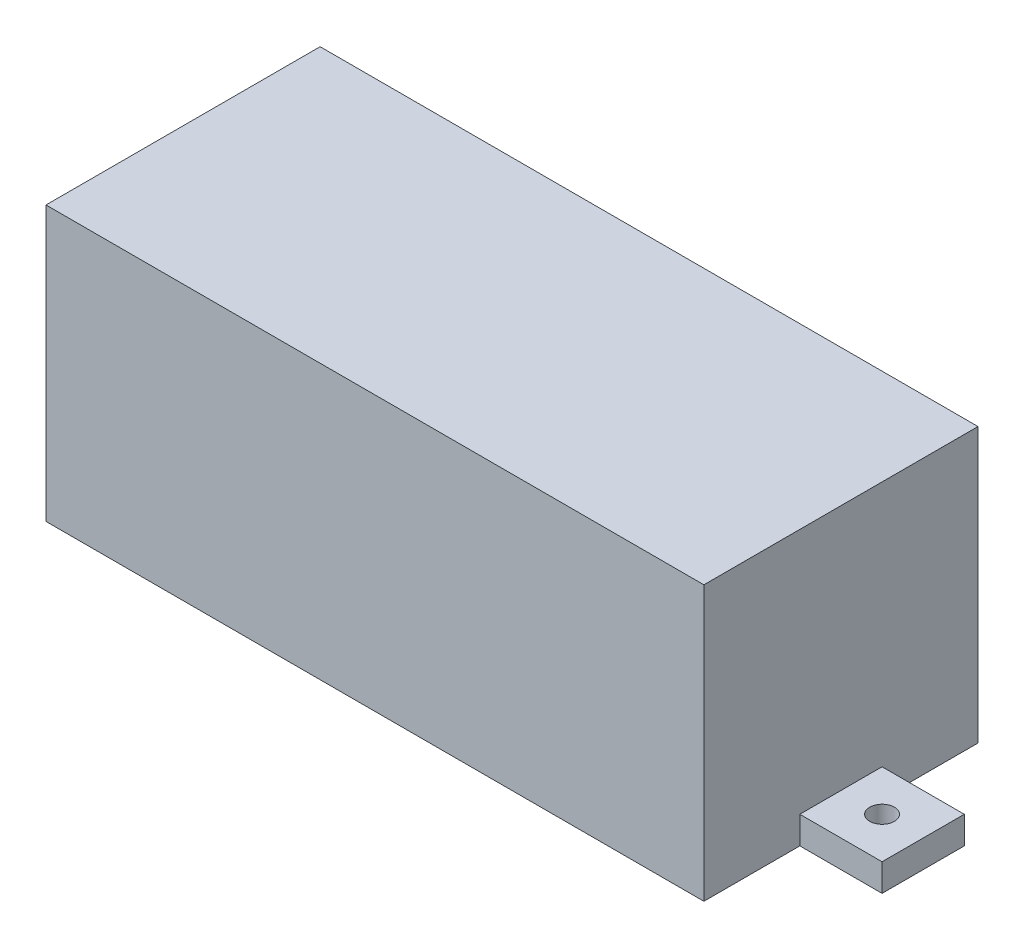
from build123d import *

# Parameters (mm, degrees)
BOSS_EXTRU_2_DEPTH   = 50
R_SERVOIR_TEST_3_W   = 15
R_SERVOIR_TEST_3_H   = 15
BOSS_EXTRU_3_DEPTH   = 5
D_GAGEMENT_M41_D     = 4.5
D_GAGEMENT_M41_DEPTH = 5
D_GAGEMENT_M41_TIP   = 1.351936393
COQUE3_START         = 2
COQUE3_OUTLINE_W     = 116
COQUE3_OUTLINE_H     = 46
COQUE3_DEPTH         = 46
COQUE3_2_OUTLINE_W   = 15
COQUE3_2_OUTLINE_H   = 11
COQUE3_2_OUTLINE_R   = 4.25
COQUE3_2_DEPTH       = 1


# Read off the part's stored shape, not the designer's step: Coque3
with BuildPart() as part:
    # Réservoir test → Boss.-Extru.2 (new body)
    with BuildSketch(Plane(origin=(0, 0, 0), x_dir=(1, 0, 0), z_dir=(0, 1, 0))):
        Polygon((60, 0), (60, 50), (0, 50), (0, 32.5), (0, 17.5), (0, 0), align=None)
        Polygon((120, 50), (60, 50), (60, 0), (120, 0), (120, 17.5), (120, 32.5), align=None)
    extrude(amount=BOSS_EXTRU_2_DEPTH)

    # Réservoir test<3> → Boss.-Extru.3 (add)
    with BuildSketch(Plane(origin=(0, 0, 0), x_dir=(1, 0, 0), z_dir=(0, 1, 0))):
        with Locations((-7.5, 25)):
            Rectangle(R_SERVOIR_TEST_3_W, R_SERVOIR_TEST_3_H)
        with Locations((127.5, 25)):
            Rectangle(R_SERVOIR_TEST_3_W, R_SERVOIR_TEST_3_H)
    extrude(amount=BOSS_EXTRU_3_DEPTH)

    # Dégagement M41
    with Locations(Plane(origin=(0, 5, 0), x_dir=(1, 0, 0), z_dir=(0, 1, 0))):
        with Locations((-7.5, 25), (127.5, 25)):
            Hole(D_GAGEMENT_M41_D / 2, depth=D_GAGEMENT_M41_DEPTH)
            with Locations((0, 0, -(D_GAGEMENT_M41_DEPTH + D_GAGEMENT_M41_TIP / 2))):  # 118° drill point
                Cone(0, D_GAGEMENT_M41_D / 2, D_GAGEMENT_M41_TIP, mode=Mode.SUBTRACT)

    # Coque3 outline → Coque3 (cut)
    with BuildSketch(Plane(origin=(0, 0, 0), x_dir=(1, 0, 0), z_dir=(0, 1, 0)).offset(COQUE3_START)):
        with Locations((60, 25)):
            Rectangle(COQUE3_OUTLINE_W, COQUE3_OUTLINE_H)
    extrude(amount=COQUE3_DEPTH, mode=Mode.SUBTRACT)

    # Coque3 2 outline → Coque3 2 (cut)
    # profile 1 of 2: a face of its own
    with BuildSketch(Plane(origin=(0, 0, 0), x_dir=(1, 0, 0), z_dir=(0, 1, 0)).offset(COQUE3_START)):
        with Locations((125.5, 25)):
            Rectangle(COQUE3_2_OUTLINE_W, COQUE3_2_OUTLINE_H)
        with Locations((127.5, 25)):
            Circle(COQUE3_2_OUTLINE_R, mode=Mode.SUBTRACT)
    # profile 2 of 2: a face of its own
    with BuildSketch(Plane(origin=(0, 0, 0), x_dir=(1, 0, 0), z_dir=(0, 1, 0)).offset(COQUE3_START)):
        with Locations((-5.5, 25)):
            Rectangle(COQUE3_2_OUTLINE_W, COQUE3_2_OUTLINE_H)
        with Locations((-7.5, 25)):
            Circle(COQUE3_2_OUTLINE_R, mode=Mode.SUBTRACT)
    extrude(amount=COQUE3_2_DEPTH, mode=Mode.SUBTRACT)


solid = part.part
